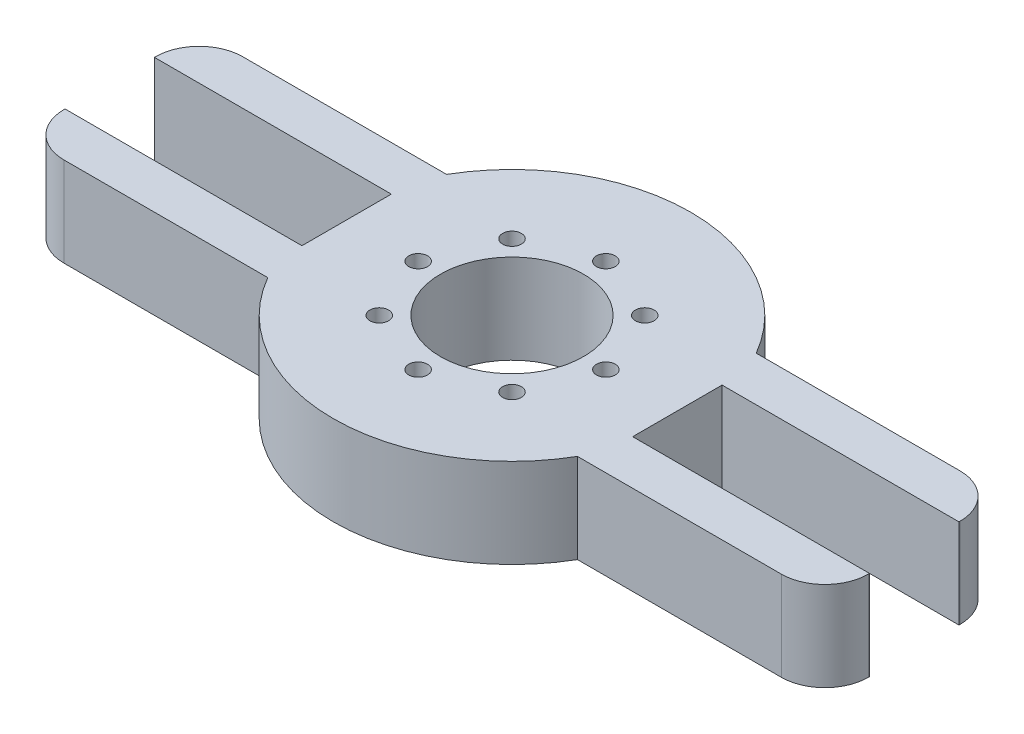
from build123d import *
from build123d.topology import SkipClean

# Parameters (mm, degrees)
BOSS_EXTRUDE1_DEPTH  = 20
SKETCH2_W            = 53
SKETCH2_H            = 20
CUT_EXTRUDE1_DEPTH   = 20
FILLET1_R            = 9.75
FILLET1_OF_MIRROR4_R = 9.75
SKETCH4_R            = 2.1
CUT_EXTRUDE3_DEPTH   = 20


with BuildPart() as part:
    # Sketch1 → Boss-Extrude1 (new body)
    with BuildSketch(Plane(origin=(0, 0, 0), x_dir=(1, 0, 0), z_dir=(0, 1, 0))):
        with BuildLine():
            Line((34.641016151, 20), (90, 20))
            Line((90, 20), (90, -20))
            Line((90, -20), (34.641016151, -20))
            ThreePointArc((34.641016151, -20), (20, -34.641016151), (0, -40))
            Line((0, -40), (0, -20))
            Line((0, -20), (0, 20))
            Line((0, 20), (0, 40))
            ThreePointArc((0, 40), (20, 34.641016151), (34.641016151, 20))
        make_face()
    boss_extrude1 = extrude(amount=BOSS_EXTRUDE1_DEPTH)

    # Sketch2 → Cut-Extrude1 (cut)
    with BuildSketch(Plane(origin=(0, 20, 0), x_dir=(1, 0, 0), z_dir=(0, 1, 0))):
        with BuildLine():
            Line((0, 16), (0, -16))
            ThreePointArc((0, -16), (16, 0), (0, 16))
        make_face()
        with Locations((63.5, 0)):
            Rectangle(SKETCH2_W, SKETCH2_H)
    cut_extrude1 = extrude(amount=-CUT_EXTRUDE1_DEPTH, mode=Mode.SUBTRACT)

    # Fillet1
    fillet1_edges = [part.edges().sort_by_distance(p)[0] for p in [
        (90, 10, -20),
        (90, 10, 20),
    ]]
    fillet(fillet1_edges, radius=FILLET1_R)

    # Mirror4: Boss-Extrude1, Cut-Extrude1 across plane
    with SkipClean():  # the faces are left unmerged after this step: merging them gives an invalid solid
        add(boss_extrude1.mirror(Plane(origin=(0, 0, 0), x_dir=(0, 0, 1), z_dir=(1, 0, 0))))
        add(cut_extrude1.mirror(Plane(origin=(0, 0, 0), x_dir=(0, 0, 1), z_dir=(1, 0, 0))), mode=Mode.SUBTRACT)
    add(part.part.scale(1), mode=Mode.REPLACE)  # the faces are merged on a copy

    # Fillet1 of Mirror4
    fillet1_of_mirror4_edges = [part.edges().sort_by_distance(p)[0] for p in [
        (-90, 10, -20),
        (-90, 10, 20),
    ]]
    fillet(fillet1_of_mirror4_edges, radius=FILLET1_OF_MIRROR4_R)

    # Sketch4 → Cut-Extrude3 (cut)
    with BuildSketch(Plane(origin=(0, 20, 0), x_dir=(1, 0, 0), z_dir=(0, 1, 0))):
        with Locations(Location((21, 0, 0), (0, 0, 270))):
            Circle(SKETCH4_R)
        with Locations(Location((14.849242405, -14.849242405, 0), (0, 0, 270))):
            Circle(SKETCH4_R)
        with Locations(Location((0, -21, 0), (0, 0, 270))):
            Circle(SKETCH4_R)
        with Locations(Location((-14.849242405, -14.849242405, 0), (0, 0, 270))):
            Circle(SKETCH4_R)
        with Locations(Location((-21, 0, 0), (0, 0, 270))):
            Circle(SKETCH4_R)
        with Locations(Location((-14.849242405, 14.849242405, 0), (0, 0, 270))):
            Circle(SKETCH4_R)
        with Locations(Location((0, 21, 0), (0, 0, 270))):
            Circle(SKETCH4_R)
        with Locations(Location((14.849242405, 14.849242405, 0), (0, 0, 270))):
            Circle(SKETCH4_R)
    extrude(amount=-CUT_EXTRUDE3_DEPTH, mode=Mode.SUBTRACT)


solid = part.part
